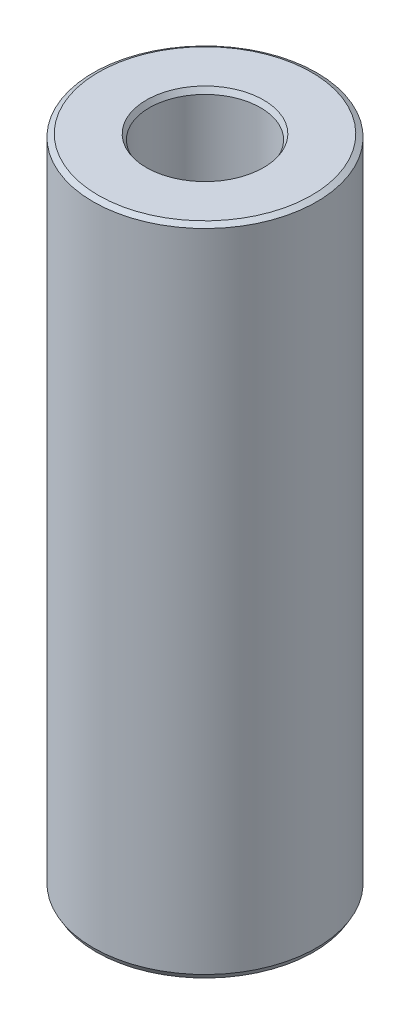
from build123d import *
from OCP.BRepFilletAPI import BRepFilletAPI_MakeChamfer

# Parameters (mm, degrees)
SKETCH1_R           = 47.5
BOSS_EXTRUDE1_DEPTH = 277.966833475
SKETCH2_R           = 23.629378045
CUT_EXTRUDE1_DEPTH  = 286.96863554
CHAMFER1_SIZE       = 1.269337131
CHAMFER1_SIZE2      = 2.198556403


with BuildPart() as part:
    # Sketch1 → Boss-Extrude1 (new body)
    with BuildSketch(Plane(origin=(0, 0, 0), x_dir=(1, 0, 0), z_dir=(0, 1, 0))):
        Circle(SKETCH1_R)
    extrude(amount=BOSS_EXTRUDE1_DEPTH)

    # Sketch2 → Cut-Extrude1 (cut, through all)
    with BuildSketch(Plane(origin=(0, 0, 0), x_dir=(1, 0, 0), z_dir=(0, 1, 0))):
        Circle(SKETCH2_R)
    extrude(amount=CUT_EXTRUDE1_DEPTH, mode=Mode.SUBTRACT)

    # Chamfer1: one chamfer whose edges measure the first distance from different faces: ONE call of the kernel's chamfer builder (chamfer() names one face for all edges)
    chamfer1_edges_1 = [part.edges().sort_by_distance(p)[0] for p in [
        (-23.629378045, 277.966833475, 0),
    ]]
    chamfer1_side_1 = [part.faces().sort_by_distance(p)[0] for p in [
        (-46.156497116, 277.966833475, 0),
    ]]
    chamfer1_edges_2 = [part.edges().sort_by_distance(p)[0] for p in [
        (-23.629378045, 0, 0),
    ]]
    chamfer1_side_2 = [part.faces().sort_by_distance(p)[0] for p in [
        (-23.629378045, 138.983416738, 0),
    ]]
    chamfer1_edges_3 = [part.edges().sort_by_distance(p)[0] for p in [
        (-47.5, 0, 0),
    ]]
    chamfer1_side_3 = [part.faces().sort_by_distance(p)[0] for p in [
        (-46.156497116, 0, 0),
    ]]
    chamfer1_edges_4 = [part.edges().sort_by_distance(p)[0] for p in [
        (-47.5, 277.966833475, 0),
    ]]
    chamfer1_side_4 = [part.faces().sort_by_distance(p)[0] for p in [
        (-47.5, 138.983416738, 0),
    ]]
    chamfer1 = BRepFilletAPI_MakeChamfer(part.part.solid().wrapped)
    for e in chamfer1_edges_1:
        chamfer1.Add(CHAMFER1_SIZE, CHAMFER1_SIZE2, e.wrapped, chamfer1_side_1[0].wrapped)  # the first distance lies on this face
    for e in chamfer1_edges_2:
        chamfer1.Add(CHAMFER1_SIZE, CHAMFER1_SIZE2, e.wrapped, chamfer1_side_2[0].wrapped)  # the first distance lies on this face
    for e in chamfer1_edges_3:
        chamfer1.Add(CHAMFER1_SIZE, CHAMFER1_SIZE2, e.wrapped, chamfer1_side_3[0].wrapped)  # the first distance lies on this face
    for e in chamfer1_edges_4:
        chamfer1.Add(CHAMFER1_SIZE, CHAMFER1_SIZE2, e.wrapped, chamfer1_side_4[0].wrapped)  # the first distance lies on this face
    add(Compound.cast(chamfer1.Shape()), mode=Mode.REPLACE)


solid = part.part
